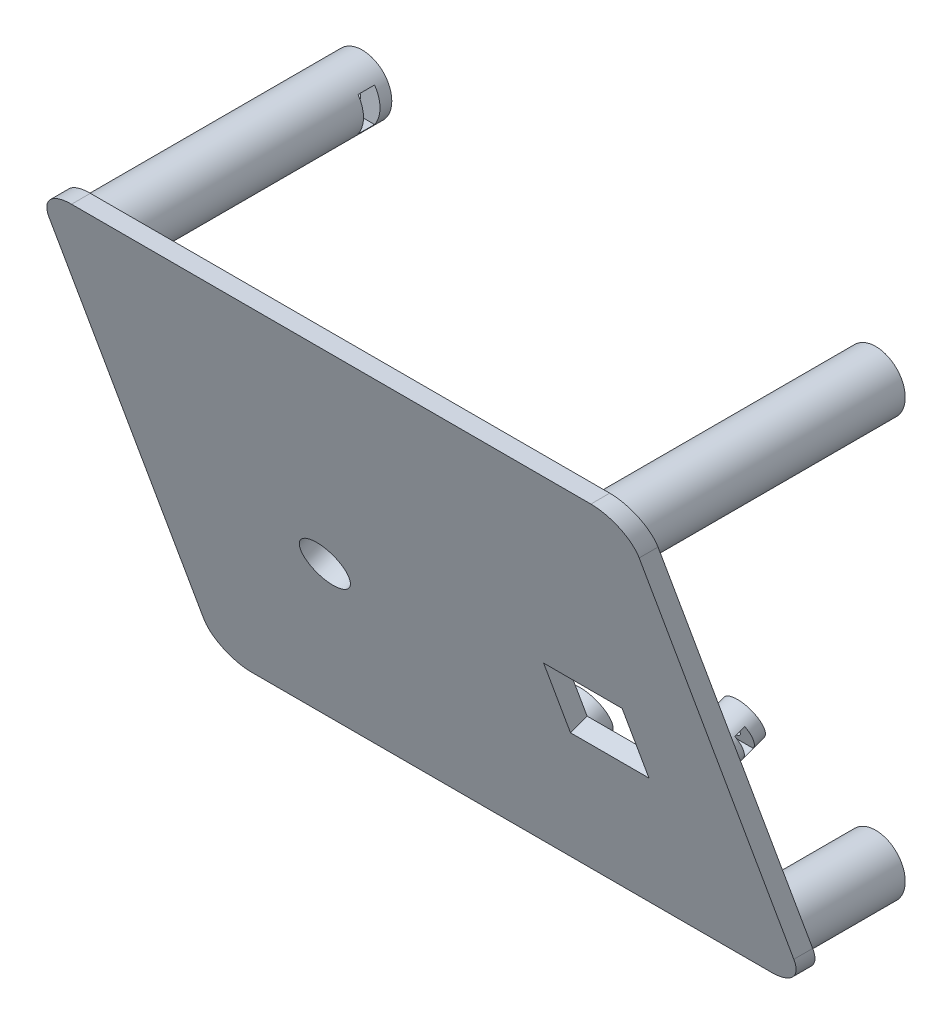
from build123d import *

# Parameters (mm, degrees)
LID_BLANK_DEPTH                 = 56
OUTER_PANEL_20DEG_DEPTH         = 143.098557347
OUTER_PANEL_20DEG_DEPTH_BACK    = 143.098557347
PANEL_3MM_DEPTH                 = 141.483885809
PANEL_3MM_DEPTH_BACK            = 141.483885809
HIDDEN_CASE_POST_0_START        = 3
SKETCH_4_R                      = 5
HIDDEN_CASE_POST_0_DEPTH        = 22.878191011
HIDDEN_CASE_POST_1_START        = 3
SKETCH_5_R                      = 5
HIDDEN_CASE_POST_1_DEPTH        = 22.878191011
HIDDEN_CASE_POST_2_START        = 3
SKETCH_6_R                      = 5
HIDDEN_CASE_POST_2_DEPTH        = 48.720077644
HIDDEN_CASE_POST_3_START        = 3
SKETCH_7_R                      = 5
HIDDEN_CASE_POST_3_DEPTH        = 48.720077644
FLUSH_OUTER_SURFACE_DEPTH       = 141.483885809
FLUSH_OUTER_SURFACE_DEPTH_BACK  = 141.483885809
BLIND_M3_0_START                = 3
SKETCH_9_R                      = 1.7
BLIND_M3_0_DEPTH                = 9.5
M3_SIDE_LOAD_NUT_0_START        = 3.1
SKETCH_10_W                     = 2.8
SKETCH_10_H                     = 5.8
M3_SIDE_LOAD_NUT_0_DEPTH        = 9.4
BLIND_M3_1_START                = 3
SKETCH_11_R                     = 1.7
BLIND_M3_1_DEPTH                = 9.5
M3_SIDE_LOAD_NUT_1_START        = 87.5
SKETCH_12_W                     = 2.8
SKETCH_12_H                     = 5.8
M3_SIDE_LOAD_NUT_1_DEPTH        = 9.4
BLIND_M3_2_START                = 3
SKETCH_13_R                     = 1.7
BLIND_M3_2_DEPTH                = 9.5
M3_SIDE_LOAD_NUT_2_START        = 3.1
SKETCH_14_W                     = 2.8
SKETCH_14_H                     = 5.8
M3_SIDE_LOAD_NUT_2_DEPTH        = 9.4
BLIND_M3_3_START                = 3
SKETCH_15_R                     = 1.7
BLIND_M3_3_DEPTH                = 9.5
M3_SIDE_LOAD_NUT_3_START        = 87.5
SKETCH_16_W                     = 2.8
SKETCH_16_H                     = 5.8
M3_SIDE_LOAD_NUT_3_DEPTH        = 9.4
SKETCH_17_R                     = 4.1
SHAFT_D8P2_DEPTH                = 5
SKETCH_18_W                     = 13.3
SKETCH_18_H                     = 13.3
BUTTON_13P3_CLEARANCE_DEPTH     = 5
SKETCH_19_R                     = 4
ENCODER_FRONT_BLIND_POST_DEPTH  = 11.07
ENCODER_FRONT_BLIND_SCREW_START = -14.07
SKETCH_20_R                     = 1.15
ENCODER_FRONT_BLIND_SCREW_DEPTH = 5
ENCODER_FRONT_M2_SIDE_NUT_START = 20.5
ENCODER_FRONT_M2_SIDE_NUT_DEPTH = 7.5
SKETCH_22_R                     = 4
ENCODER_REAR_BLIND_POST_DEPTH   = 11.07
ENCODER_REAR_BLIND_SCREW_START  = -14.07
SKETCH_23_R                     = 1.15
ENCODER_REAR_BLIND_SCREW_DEPTH  = 5
ENCODER_REAR_M2_SIDE_NUT_START  = 44.5
ENCODER_REAR_M2_SIDE_NUT_DEPTH  = 7.5
SKETCH_25_R                     = 4
BUTTON_LEFT_BLIND_POST_DEPTH    = 6.7
BUTTON_LEFT_BLIND_SCREW_START   = -9.7
SKETCH_26_R                     = 1.15
BUTTON_LEFT_BLIND_SCREW_DEPTH   = 5
BUTTON_LEFT_M2_SIDE_NUT_START   = 57.5
BUTTON_LEFT_M2_SIDE_NUT_DEPTH   = 7.5
SKETCH_28_R                     = 3.4
BUTTON_RIGHT_BLIND_POST_DEPTH   = 6.7
BUTTON_RIGHT_BLIND_SCREW_START  = -9.7
SKETCH_29_R                     = 1.15
BUTTON_RIGHT_BLIND_SCREW_DEPTH  = 5
BUTTON_RIGHT_M2_SIDE_NUT_START  = 90.8
BUTTON_RIGHT_M2_SIDE_NUT_DEPTH  = 7.5


with BuildPart() as part:
    # 草图1 → Lid_blank (new body)
    with BuildSketch(Plane.XY):
        with BuildLine():
            Line((6, 0), (94, 0))
            ThreePointArc((94, 0), (98.242640687, 1.757359313), (100, 6))
            Line((100, 6), (100, 78))
            ThreePointArc((100, 78), (98.242640687, 82.242640687), (94, 84))
            Line((94, 84), (6, 84))
            ThreePointArc((6, 84), (1.757359313, 82.242640687), (0, 78))
            Line((0, 78), (0, 6))
            ThreePointArc((0, 6), (1.757359313, 1.757359313), (6, 0))
        make_face()
    extrude(amount=LID_BLANK_DEPTH)

    # 草图2 → Outer_panel_20deg (cut, two sides: drawn at the far end of the back side and taken through both)
    with BuildSketch(Plane(origin=(0, 0, 0), x_dir=(0, 0, -1), z_dir=(1, 0, 0)).offset(-OUTER_PANEL_20DEG_DEPTH_BACK)):
        Polygon((-13.913128632, -20), (-61.229259087, 110), (-120, 110), (-120, -20), align=None)
    extrude(amount=OUTER_PANEL_20DEG_DEPTH + OUTER_PANEL_20DEG_DEPTH_BACK, mode=Mode.SUBTRACT)

    # 草图3 → Panel_3mm (cut, two sides: drawn at the far end of the back side and taken through both)
    with BuildSketch(Plane(origin=(0, 0, 0), x_dir=(0, 0, -1), z_dir=(1, 0, 0)).offset(-PANEL_3MM_DEPTH_BACK)):
        Polygon((-10.720595315, -20), (-58.036725769, 110), (30, 110), (30, -20), align=None)
    extrude(amount=PANEL_3MM_DEPTH + PANEL_3MM_DEPTH_BACK, mode=Mode.SUBTRACT)

    # 草图4 → Hidden_case_post_0 (add)
    with BuildSketch(Plane.XY.offset(HIDDEN_CASE_POST_0_START)):
        with Locations((6.5, 6.5)):
            Circle(SKETCH_4_R)
    extrude(amount=HIDDEN_CASE_POST_0_DEPTH)

    # 草图5 → Hidden_case_post_1 (add)
    with BuildSketch(Plane.XY.offset(HIDDEN_CASE_POST_1_START)):
        with Locations((93.5, 6.5)):
            Circle(SKETCH_5_R)
    extrude(amount=HIDDEN_CASE_POST_1_DEPTH)

    # 草图6 → Hidden_case_post_2 (add)
    with BuildSketch(Plane.XY.offset(HIDDEN_CASE_POST_2_START)):
        with Locations((6.5, 77.5)):
            Circle(SKETCH_6_R)
    extrude(amount=HIDDEN_CASE_POST_2_DEPTH)

    # 草图7 → Hidden_case_post_3 (add)
    with BuildSketch(Plane.XY.offset(HIDDEN_CASE_POST_3_START)):
        with Locations((93.5, 77.5)):
            Circle(SKETCH_7_R)
    extrude(amount=HIDDEN_CASE_POST_3_DEPTH)

    # 草图8 → Flush_outer_surface (cut, two sides: drawn at the far end of the back side and taken through both)
    with BuildSketch(Plane(origin=(0, 0, 0), x_dir=(0, 0, -1), z_dir=(1, 0, 0)).offset(-FLUSH_OUTER_SURFACE_DEPTH_BACK)):
        Polygon((-13.913128632, -20), (-61.229259087, 110), (-120, 110), (-120, -20), align=None)
    extrude(amount=FLUSH_OUTER_SURFACE_DEPTH + FLUSH_OUTER_SURFACE_DEPTH_BACK, mode=Mode.SUBTRACT)

    # 草图9 → Blind_M3_0 (cut)
    with BuildSketch(Plane.XY.offset(BLIND_M3_0_START)):
        with Locations((6.5, 6.5)):
            Circle(SKETCH_9_R)
    extrude(amount=BLIND_M3_0_DEPTH, mode=Mode.SUBTRACT)

    # 草图10 → M3_side_load_nut_0 (cut)
    with BuildSketch(Plane(origin=(0, 0, 0), x_dir=(0, 0, -1), z_dir=(1, 0, 0)).offset(M3_SIDE_LOAD_NUT_0_START)):
        with Locations((-6.4, 6.5)):
            Rectangle(SKETCH_10_W, SKETCH_10_H)
    extrude(amount=M3_SIDE_LOAD_NUT_0_DEPTH, mode=Mode.SUBTRACT)

    # 草图11 → Blind_M3_1 (cut)
    with BuildSketch(Plane.XY.offset(BLIND_M3_1_START)):
        with Locations((93.5, 6.5)):
            Circle(SKETCH_11_R)
    extrude(amount=BLIND_M3_1_DEPTH, mode=Mode.SUBTRACT)

    # 草图12 → M3_side_load_nut_1 (cut)
    with BuildSketch(Plane(origin=(0, 0, 0), x_dir=(0, 0, -1), z_dir=(1, 0, 0)).offset(M3_SIDE_LOAD_NUT_1_START)):
        with Locations((-6.4, 6.5)):
            Rectangle(SKETCH_12_W, SKETCH_12_H)
    extrude(amount=M3_SIDE_LOAD_NUT_1_DEPTH, mode=Mode.SUBTRACT)

    # 草图13 → Blind_M3_2 (cut)
    with BuildSketch(Plane.XY.offset(BLIND_M3_2_START)):
        with Locations((6.5, 77.5)):
            Circle(SKETCH_13_R)
    extrude(amount=BLIND_M3_2_DEPTH, mode=Mode.SUBTRACT)

    # 草图14 → M3_side_load_nut_2 (cut)
    with BuildSketch(Plane(origin=(0, 0, 0), x_dir=(0, 0, -1), z_dir=(1, 0, 0)).offset(M3_SIDE_LOAD_NUT_2_START)):
        with Locations((-6.4, 77.5)):
            Rectangle(SKETCH_14_W, SKETCH_14_H)
    extrude(amount=M3_SIDE_LOAD_NUT_2_DEPTH, mode=Mode.SUBTRACT)

    # 草图15 → Blind_M3_3 (cut)
    with BuildSketch(Plane.XY.offset(BLIND_M3_3_START)):
        with Locations((93.5, 77.5)):
            Circle(SKETCH_15_R)
    extrude(amount=BLIND_M3_3_DEPTH, mode=Mode.SUBTRACT)

    # 草图16 → M3_side_load_nut_3 (cut)
    with BuildSketch(Plane(origin=(0, 0, 0), x_dir=(0, 0, -1), z_dir=(1, 0, 0)).offset(M3_SIDE_LOAD_NUT_3_START)):
        with Locations((-6.4, 77.5)):
            Rectangle(SKETCH_16_W, SKETCH_16_H)
    extrude(amount=M3_SIDE_LOAD_NUT_3_DEPTH, mode=Mode.SUBTRACT)

    # 草图17 → Shaft_D8p2 (cut)
    with BuildSketch(Plane(origin=(0, -6.811148917, 18.71347785), x_dir=(1, 0, 0), z_dir=(0, -0.3420201433256689, 0.9396926207859084))):
        with Locations((31, 44.248273283)):
            Circle(SKETCH_17_R)
    extrude(amount=-SHAFT_D8P2_DEPTH, mode=Mode.SUBTRACT)

    # 草图18 → Button_13p3_clearance (cut)
    with BuildSketch(Plane(origin=(0, -6.811148917, 18.71347785), x_dir=(1, 0, 0), z_dir=(0, -0.3420201433256689, 0.9396926207859084))):
        with Locations((77, 44.248273283)):
            Rectangle(SKETCH_18_W, SKETCH_18_H)
    extrude(amount=-BUTTON_13P3_CLEARANCE_DEPTH, mode=Mode.SUBTRACT)

    # 草图19 → Encoder_front_blind_post (add)
    with BuildSketch(Plane(origin=(0, -5.785088487, 15.894399988), x_dir=(-1, 0, 0), z_dir=(0, 0.34202014332566866, -0.9396926207859085))):
        with Locations((-23, 30.748273283)):
            Circle(SKETCH_19_R)
    extrude(amount=ENCODER_FRONT_BLIND_POST_DEPTH)

    # 草图20 → Encoder_front_blind_screw (cut)
    with BuildSketch(Plane(origin=(0, -6.811148917, 18.71347785), x_dir=(1, 0, 0), z_dir=(0, -0.3420201433256689, 0.9396926207859084)).offset(ENCODER_FRONT_BLIND_SCREW_START)):
        with Locations((23, 30.748273283)):
            Circle(SKETCH_20_R)
    extrude(amount=ENCODER_FRONT_BLIND_SCREW_DEPTH, mode=Mode.SUBTRACT)

    # 草图21 → Encoder_front_M2_side_nut (cut)
    with BuildSketch(Plane(origin=(0, 0, 0), x_dir=(0, 0, -1), z_dir=(1, 0, 0)).offset(ENCODER_FRONT_M2_SIDE_NUT_START)):
        Polygon((-17.169674452, 24.237605215), (-18.606159054, 28.184314222), (-20.297605771, 27.568677964), (-18.861121169, 23.621968957), align=None)
    extrude(amount=ENCODER_FRONT_M2_SIDE_NUT_DEPTH, mode=Mode.SUBTRACT)

    # 草图22 → Encoder_rear_blind_post (add)
    with BuildSketch(Plane(origin=(0, -5.785088487, 15.894399988), x_dir=(-1, 0, 0), z_dir=(0, 0.34202014332566866, -0.9396926207859085))):
        with Locations((-47, 57.748273283)):
            Circle(SKETCH_22_R)
    extrude(amount=ENCODER_REAR_BLIND_POST_DEPTH)

    # 草图23 → Encoder_rear_blind_screw (cut)
    with BuildSketch(Plane(origin=(0, -6.811148917, 18.71347785), x_dir=(1, 0, 0), z_dir=(0, -0.3420201433256689, 0.9396926207859084)).offset(ENCODER_REAR_BLIND_SCREW_START)):
        with Locations((47, 57.748273283)):
            Circle(SKETCH_23_R)
    extrude(amount=ENCODER_REAR_BLIND_SCREW_DEPTH, mode=Mode.SUBTRACT)

    # 草图24 → Encoder_rear_M2_side_nut (cut)
    with BuildSketch(Plane(origin=(0, 0, 0), x_dir=(0, 0, -1), z_dir=(1, 0, 0)).offset(ENCODER_REAR_M2_SIDE_NUT_START)):
        Polygon((-26.404218322, 49.609305976), (-27.840702923, 53.556014983), (-29.532149641, 52.940378725), (-28.095665039, 48.993669718), align=None)
    extrude(amount=ENCODER_REAR_M2_SIDE_NUT_DEPTH, mode=Mode.SUBTRACT)

    # 草图25 → Button_left_blind_post (add)
    with BuildSketch(Plane(origin=(0, -5.785088487, 15.894399988), x_dir=(-1, 0, 0), z_dir=(0, 0.34202014332566866, -0.9396926207859085))):
        with Locations((-60, 25.248273283)):
            Circle(SKETCH_25_R)
    extrude(amount=BUTTON_LEFT_BLIND_POST_DEPTH)

    # 草图26 → Button_left_blind_screw (cut)
    with BuildSketch(Plane(origin=(0, -6.811148917, 18.71347785), x_dir=(1, 0, 0), z_dir=(0, -0.3420201433256689, 0.9396926207859084)).offset(BUTTON_LEFT_BLIND_SCREW_START)):
        with Locations((60, 25.248273283)):
            Circle(SKETCH_26_R)
    extrude(amount=BUTTON_LEFT_BLIND_SCREW_DEPTH, mode=Mode.SUBTRACT)

    # 草图27 → Button_left_M2_side_nut (cut)
    with BuildSketch(Plane(origin=(0, 0, 0), x_dir=(0, 0, -1), z_dir=(1, 0, 0)).offset(BUTTON_LEFT_M2_SIDE_NUT_START)):
        Polygon((-19.395020416, 17.574667774), (-20.831505018, 21.521376781), (-22.522951736, 20.905740523), (-21.086467134, 16.959031516), align=None)
    extrude(amount=BUTTON_LEFT_M2_SIDE_NUT_DEPTH, mode=Mode.SUBTRACT)

    # 草图28 → Button_right_blind_post (add)
    with BuildSketch(Plane(origin=(0, -5.785088487, 15.894399988), x_dir=(-1, 0, 0), z_dir=(0, 0.34202014332566866, -0.9396926207859085))):
        with Locations((-93.3, 45.248273283)):
            Circle(SKETCH_28_R)
    extrude(amount=BUTTON_RIGHT_BLIND_POST_DEPTH)

    # 草图29 → Button_right_blind_screw (cut)
    with BuildSketch(Plane(origin=(0, -6.811148917, 18.71347785), x_dir=(1, 0, 0), z_dir=(0, -0.3420201433256689, 0.9396926207859084)).offset(BUTTON_RIGHT_BLIND_SCREW_START)):
        with Locations((93.3, 45.248273283)):
            Circle(SKETCH_29_R)
    extrude(amount=BUTTON_RIGHT_BLIND_SCREW_DEPTH, mode=Mode.SUBTRACT)

    # 草图30 → Button_right_M2_side_nut (cut)
    with BuildSketch(Plane(origin=(0, 0, 0), x_dir=(0, 0, -1), z_dir=(1, 0, 0)).offset(BUTTON_RIGHT_M2_SIDE_NUT_START)):
        Polygon((-26.235423283, 36.36852019), (-27.671907885, 40.315229197), (-29.363354602, 39.699592939), (-27.92687, 35.752883932), align=None)
    extrude(amount=BUTTON_RIGHT_M2_SIDE_NUT_DEPTH, mode=Mode.SUBTRACT)


solid = part.part
